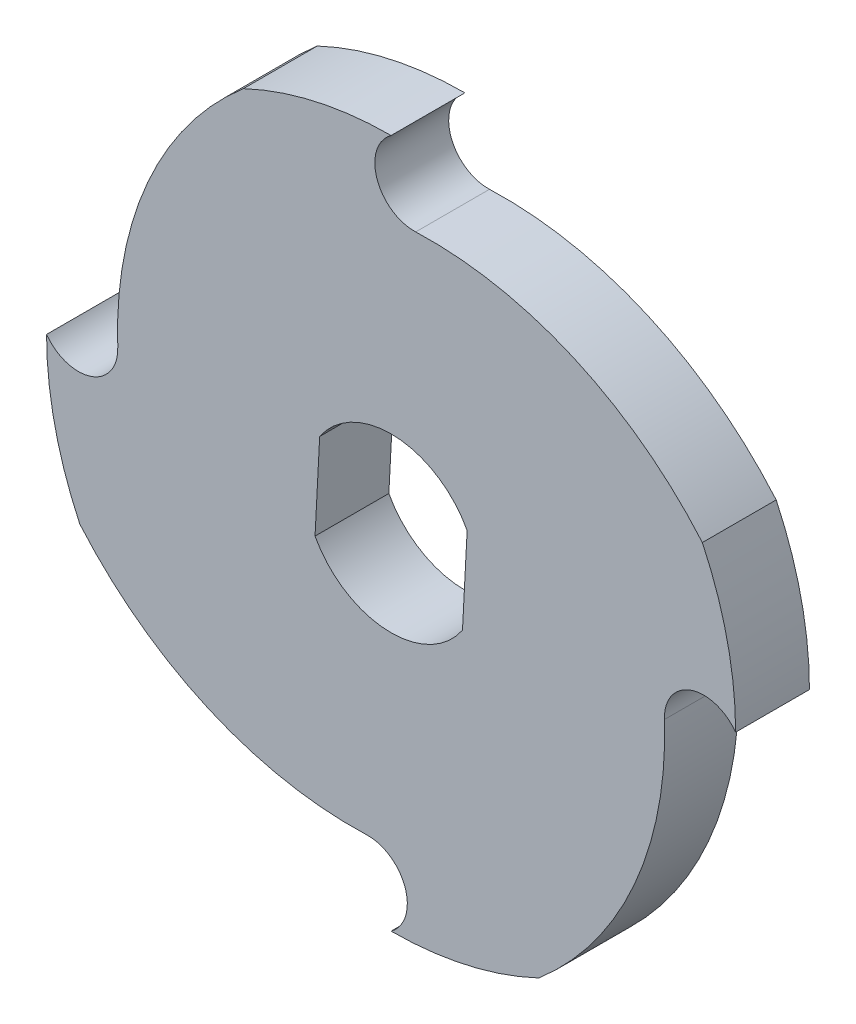
from build123d import *

# Parameters (mm, degrees)
TABAN_FLAN_1_DEPTH    = 15
KES_EKSTR_ZYON1_DEPTH = 101.124921973


# Sheet-metal steps are written as plain solids
with BuildPart() as part:
    # Çizim1 → Taban-Flanş1 (new body)
    with BuildSketch(Plane.XY):
        with BuildLine():
            ThreePointArc((-70, 0), (-68.290514437, -15.375488216), (-63.245553203, -30))
            ThreePointArc((-63.245553203, -30), (-37.049172752, -49.441795719), (-5, -55.531483348))
            ThreePointArc((-5, -55.531483348), (2.861742557, -60.912841793), (0, -70))
            ThreePointArc((0, -70), (15.375488216, -68.290514437), (30, -63.245553203))
            ThreePointArc((30, -63.245553203), (49.441795719, -37.049172752), (55.531483348, -5))
            ThreePointArc((55.531483348, -5), (60.912841793, 2.861742557), (70, 0))
            ThreePointArc((70, 0), (68.290514437, 15.375488216), (63.245553203, 30))
            ThreePointArc((63.245553203, 30), (37.049172752, 49.441795719), (5, 55.531483348))
            ThreePointArc((5, 55.531483348), (-2.861742557, 60.912841793), (0, 70))
            ThreePointArc((0, 70), (-15.375488216, 68.290514437), (-30, 63.245553203))
            ThreePointArc((-30, 63.245553203), (-49.441795719, 37.049172752), (-55.531483348, 5))
            ThreePointArc((-55.531483348, 5), (-60.912841793, -2.861742557), (-70, 0))
        make_face()
    extrude(amount=-TABAN_FLAN_1_DEPTH)

    # Çizim8 → Kes-Ekstrüzyon1 (cut, through all)
    with BuildSketch(Plane.XY):
        with BuildLine():
            Line((-15.451192956, -8.216485638), (-14.507693087, 9.786564326))
            ThreePointArc((-14.507693087, 9.786564326), (0.915879234, 17.476016858), (15.451192956, 8.216485638))
            Line((15.451192956, 8.216485638), (14.507693087, -9.786564326))
            ThreePointArc((14.507693087, -9.786564326), (-0.915879234, -17.476016858), (-15.451192956, -8.216485638))
        make_face()
    extrude(amount=-KES_EKSTR_ZYON1_DEPTH, mode=Mode.SUBTRACT)


solid = part.part
